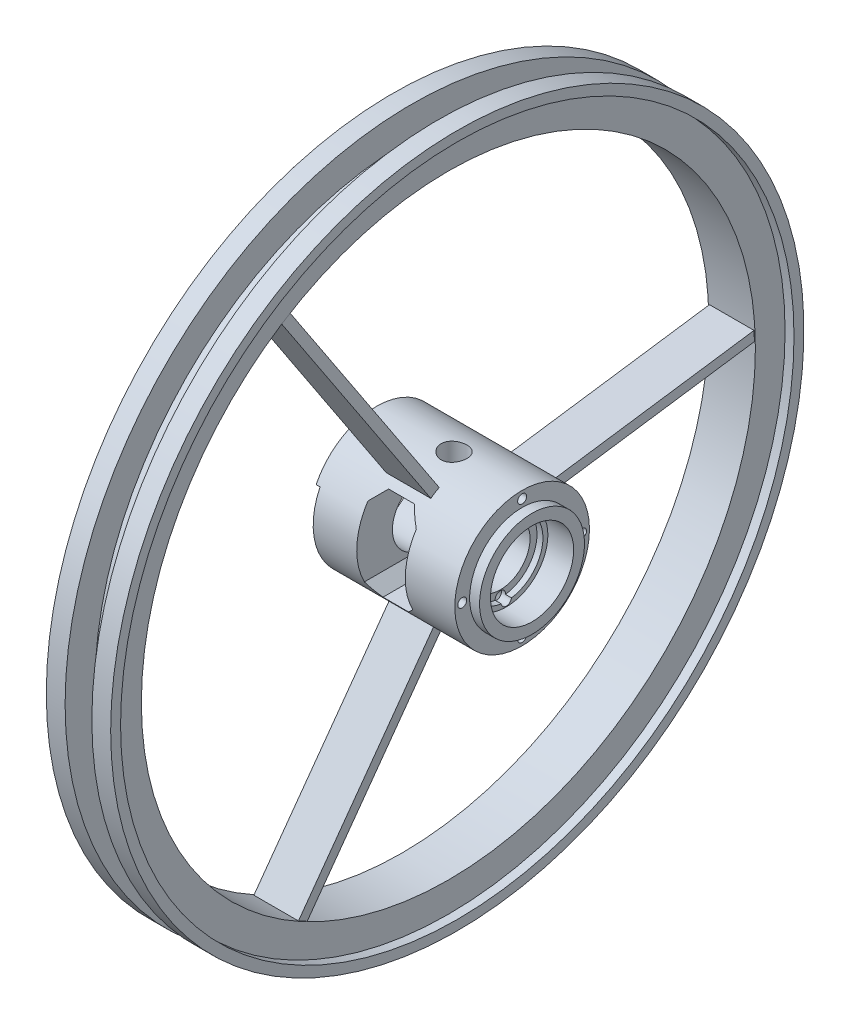
from build123d import *

# Parameters (mm, degrees)
SKETCH1_R                          = 68
BOSS_EXTRUDE1_DEPTH                = 157
CUT_EXTRUDE1_REACH                 = 186.111
SKETCH2_R                          = 26
SKETCH3_W                          = 136
SKETCH3_H                          = 98
CUT_EXTRUDE2_DEPTH                 = 4
CUT_EXTRUDE3_DEPTH                 = 44
SKETCH7_R                          = 42
CUT_EXTRUDE4_DEPTH                 = 26
SKETCH8_R                          = 37
CUT_EXTRUDE5_DEPTH                 = 6
SKETCH9_R                          = 30
CUT_EXTRUDE6_DEPTH                 = 30
CUT_EXTRUDE8_DEPTH                 = 71
TAP_DRILL_FOR_M1_2X0_25_TAP1_D     = 26
TAP_DRILL_FOR_M1_2X0_25_TAP1_DEPTH = 68
CUT_EXTRUDE9_START                 = -10
SKETCH27_R                         = 68
SKETCH27_R_2                       = 53
CUT_EXTRUDE9_DEPTH                 = 10
M8_CLEARANCE_HOLE1_D               = 9
M8_CLEARANCE_HOLE1_DEPTH           = 35
M8_CLEARANCE_HOLE1_TIP             = 2.703872786
BOSS_EXTRUDE4_DEPTH                = 5
CIRPATTERN4_COUNT                  = 3
M10_CLEARANCE_HOLE1_D              = 10.5
M10_CLEARANCE_HOLE1_DEPTH          = 10
M10_CLEARANCE_HOLE1_TIP            = 3.15451825


with BuildPart() as part:
    # Sketch1 → Boss-Extrude1 (new body)
    with BuildSketch(Plane(origin=(0, 0, 0), x_dir=(0, 0, -1), z_dir=(1, 0, 0))):
        Circle(SKETCH1_R)
    extrude(amount=BOSS_EXTRUDE1_DEPTH)

    # Sketch2 → Cut-Extrude1 (cut, up to next)
    with BuildSketch(Plane.ZY, mode=Mode.PRIVATE) as cut_extrude1_sk1:
        Circle(SKETCH2_R)
    cut_extrude1_tool1 = extrude(cut_extrude1_sk1.sketch, amount=-CUT_EXTRUDE1_REACH, mode=Mode.PRIVATE) & part.part
    add(cut_extrude1_tool1.solids().sort_by_distance((0, 0, 0))[0], mode=Mode.SUBTRACT)

    # Sketch3 → Cut-Extrude2 (cut)
    with BuildSketch(Plane.ZY):
        with Locations((0, -19)):
            Rectangle(SKETCH3_W, SKETCH3_H)
    extrude(amount=-CUT_EXTRUDE2_DEPTH, mode=Mode.SUBTRACT)

    # Sketch4 → Cut-Extrude3 (cut)
    with BuildSketch(Plane.ZY.offset(-4)):
        with BuildLine():
            Line((-13.5, 29), (13.5, 29))
            ThreePointArc((13.5, 29), (0, -31.988279103), (-13.5, 29))
        make_face()
    extrude(amount=-CUT_EXTRUDE3_DEPTH, mode=Mode.SUBTRACT)

    # Sketch7 → Cut-Extrude4 (cut)
    with BuildSketch(Plane(origin=(157, 0, 0), x_dir=(0, 0, -1), z_dir=(1, 0, 0))):
        Circle(SKETCH7_R)
    extrude(amount=-CUT_EXTRUDE4_DEPTH, mode=Mode.SUBTRACT)

    # Sketch8 → Cut-Extrude5 (cut)
    with BuildSketch(Plane(origin=(131, 0, 0), x_dir=(0, 0, -1), z_dir=(1, 0, 0))):
        Circle(SKETCH8_R)
    extrude(amount=-CUT_EXTRUDE5_DEPTH, mode=Mode.SUBTRACT)

    # Sketch9 → Cut-Extrude6 (cut)
    with BuildSketch(Plane(origin=(125, 0, 0), x_dir=(0, 0, -1), z_dir=(1, 0, 0))):
        Circle(SKETCH9_R)
    extrude(amount=-CUT_EXTRUDE6_DEPTH, mode=Mode.SUBTRACT)

    # Sketch12 → Cut-Extrude8 (cut)
    with BuildSketch(Plane.XY.offset(68)):
        Polygon((48, 37.575966949), (48, -31.421583167), (59.373949205, -42.795532372), (85.373949205, -42.795532372), (97, -31.169481577), (97, 37.32386536), (85.373949205, 48.949916154), (59.373949205, 48.949916154), align=None)
    extrude(amount=-CUT_EXTRUDE8_DEPTH, mode=Mode.SUBTRACT)

    # Tap Drill for M1.2x0.25 Tap1
    with Locations(Plane(origin=(0, 68, 0), x_dir=(1, 0, 0), z_dir=(0, 1, 0))):
        with Locations((78.260762908, 0)):
            Hole(TAP_DRILL_FOR_M1_2X0_25_TAP1_D / 2, depth=TAP_DRILL_FOR_M1_2X0_25_TAP1_DEPTH)

    # Sketch27 → Cut-Extrude9 (cut)
    with BuildSketch(Plane(origin=(157, 0, 0), x_dir=(0, 0, -1), z_dir=(1, 0, 0)).offset(CUT_EXTRUDE9_START)):
        Circle(SKETCH27_R)
        Circle(SKETCH27_R_2, mode=Mode.SUBTRACT)
    extrude(amount=CUT_EXTRUDE9_DEPTH, mode=Mode.SUBTRACT)

    # M8 Clearance Hole1
    with Locations(Plane(origin=(147, 0, 0), x_dir=(0, 0, -1), z_dir=(1, 0, 0))):
        with Locations((-60.5, 0), (0, 60.5), (60.5, 0), (0, -60.5)):
            Hole(M8_CLEARANCE_HOLE1_D / 2, depth=M8_CLEARANCE_HOLE1_DEPTH)
            with Locations((0, 0, -(M8_CLEARANCE_HOLE1_DEPTH + M8_CLEARANCE_HOLE1_TIP / 2))):  # 118° drill point
                Cone(0, M8_CLEARANCE_HOLE1_D / 2, M8_CLEARANCE_HOLE1_TIP, mode=Mode.SUBTRACT)



with BuildPart() as body_2:
    # Sketch21 → Revolve1 (revolve)
    with BuildSketch(Plane(origin=(0, 0, 0), x_dir=(-1, 0, 0), z_dir=(0, 0.528534662230602, -0.8489117214532872))):
        Polygon((-71.519474344, 310), (-72.519474344, 310), (-72.519474344, 340), (-81.519474344, 340), (-81.519474344, 350), (-62.519474344, 350), (-62.519474344, 320), (-35.519474344, 320), (-35.519474344, 350), (-16.519474344, 350), (-16.519474344, 340), (-25.519474344, 340), (-25.519474344, 310), (-26.519474344, 310), align=None)
    revolve(axis=Axis((0, 0, 0), (1, 0, 0)))


with BuildPart() as part_1:
    add(part.part)

    add(body_2.part)  # Boss-Extrude4 merges body 2
    # Sketch19 → Boss-Extrude4 (add, symmetric)
    with BuildSketch(Plane(origin=(0, 0, 0), x_dir=(-1, 0, 0), z_dir=(0, 0.528534662230602, -0.8489117214532872))):
        Polygon((-26.519474344, 310), (-71.519474344, 310), (-95, 66.5), (-50, 66.5), align=None)
    boss_extrude4 = extrude(amount=BOSS_EXTRUDE4_DEPTH, both=True)

    # CirPattern4: Boss-Extrude4 ×3 about axis
    cirpattern4_axis = Axis((0, 0, 0), (1, 0, 0))
    for i in range(1, CIRPATTERN4_COUNT):
        add(boss_extrude4.rotate(cirpattern4_axis, i * 360 / CIRPATTERN4_COUNT))

    # M10 Clearance Hole1
    with Locations(Plane(origin=(131, 0, 0), x_dir=(0, 0, -1), z_dir=(1, 0, 0))):
        with Locations((0, -36)):
            Hole(M10_CLEARANCE_HOLE1_D / 2, depth=M10_CLEARANCE_HOLE1_DEPTH)
            with Locations((0, 0, -(M10_CLEARANCE_HOLE1_DEPTH + M10_CLEARANCE_HOLE1_TIP / 2))):  # 118° drill point
                Cone(0, M10_CLEARANCE_HOLE1_D / 2, M10_CLEARANCE_HOLE1_TIP, mode=Mode.SUBTRACT)


solid = part_1.part
